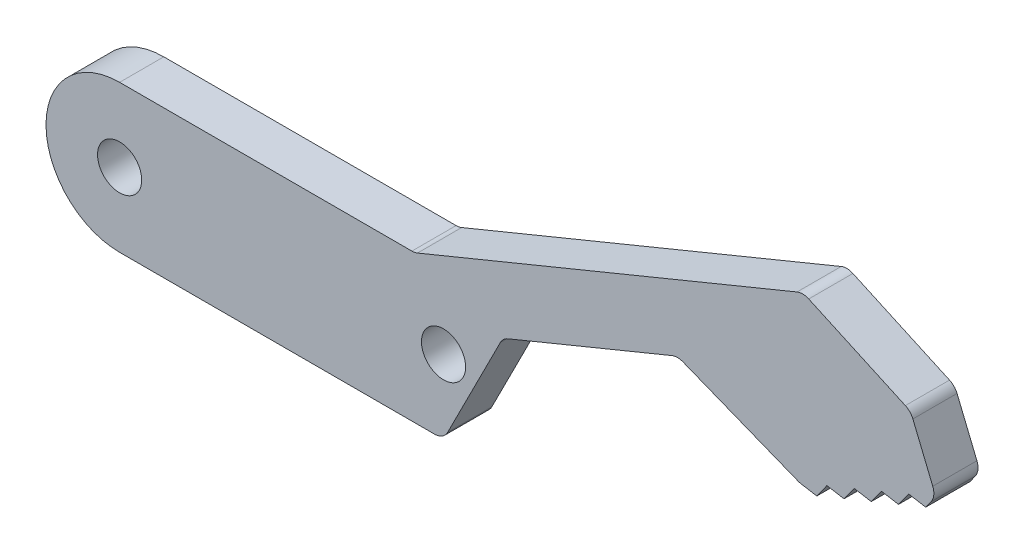
from build123d import *

# Parameters (mm, degrees)
SKETCH_1_R      = 1.5
EXTRUDE_2_DEPTH = 3
FILLET_1_R      = 1


with BuildPart() as part:
    # Эскиз1 → Бобышка-Вытянуть2 (new body)
    with BuildSketch(Plane.XY):
        with BuildLine():
            Line((20.05, 5), (0, 5))
            ThreePointArc((0, 5), (-5, 0), (0, -5))
            Line((0, -5), (22, -5))
            Line((22, -5), (26.028944647, 2.96101419))
            Line((26.028944647, 2.96101419), (37.885430159, 7.835804736))
            Line((37.885430159, 7.835804736), (46.188488025, 4.540007042))
            Line((46.188488025, 4.540007042), (47.351030887, 4.342221563))
            Line((47.351030887, 4.342221563), (48.038244482, 5.300533868))
            Line((48.038244482, 5.300533868), (49.200787343, 5.102748388))
            Line((49.200787343, 5.102748388), (49.888000938, 6.061060693))
            Line((49.888000938, 6.061060693), (51.050543799, 5.863275214))
            Line((51.050543799, 5.863275214), (51.737757394, 6.821587519))
            Line((51.737757394, 6.821587519), (52.900300256, 6.623802039))
            Line((52.900300256, 6.623802039), (53.587513851, 7.582114344))
            Line((53.587513851, 7.582114344), (54.750056712, 7.384328864))
            Line((54.750056712, 7.384328864), (55.437270307, 8.34264117))
            Line((55.437270307, 8.34264117), (53.72608495, 12.504593197))
            Line((53.72608495, 12.504593197), (46.409029503, 15.837507263))
            Line((46.409029503, 15.837507263), (20.05, 5))
        make_face()
        Circle(SKETCH_1_R, mode=Mode.SUBTRACT)
        with Locations((22, 0)):
            Circle(SKETCH_1_R, mode=Mode.SUBTRACT)
    extrude(amount=-EXTRUDE_2_DEPTH)

    # Скругление1
    fillet_1_edges = [part.edges().sort_by_distance(p)[0] for p in [
        (46.188488025, 4.540007042, -1.5),
        (55.437270307, 8.34264117, -1.5),
        (53.72608495, 12.504593197, -1.5),
        (46.409029503, 15.837507263, -1.5),
        (20.05, 5, -1.5),
        (37.885430159, 7.835804736, -1.5),
        (26.028944647, 2.96101419, -1.5),
        (22, -5, -1.5),
    ]]
    fillet(fillet_1_edges, radius=FILLET_1_R)


solid = part.part
